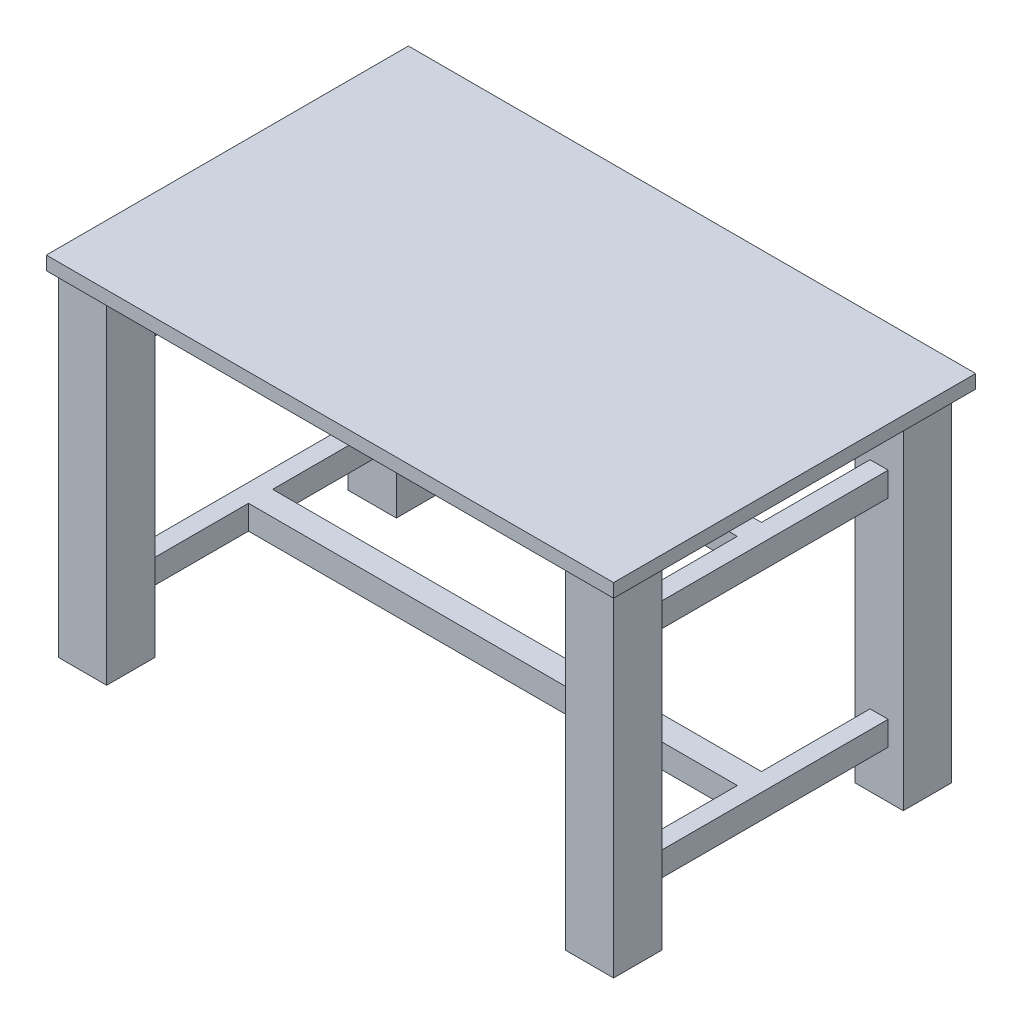
from build123d import *

# Parameters (mm, degrees)
BOSS_EXTRUDE1_DEPTH     = 704.85
CUT_EXTRUDE1_DEPTH      = 983.117366968
CUT_EXTRUDE1_DEPTH_BACK = 983.117366968
SKETCH2_W               = 508
SKETCH2_H               = 100
SKETCH2_H_2             = 403.25
SKETCH3_W               = 1193.8
SKETCH3_H               = 762
BOSS_EXTRUDE2_DEPTH     = 28.5


with BuildPart() as part:
    # Sketch1 → Boss-Extrude1 (new body)
    with BuildSketch(Plane(origin=(0, 0, 0), x_dir=(1, 0, 0), z_dir=(0, 1, 0))):
        Polygon((-584.2, 355.6), (-584.2, 254), (-552.45, 254), (-552.45, -254), (-584.2, -254), (-584.2, -355.6), (-482.6, -355.6), (-482.6, -254), (-514.35, -254), (-514.35, -25.4), (514.35, -25.4), (514.35, -254), (482.6, -254), (482.6, -355.6), (584.2, -355.6), (584.2, -254), (552.45, -254), (552.45, 254), (584.2, 254), (584.2, 355.6), (482.6, 355.6), (482.6, 254), (514.35, 254), (514.35, 25.4), (-514.35, 25.4), (-514.35, 254), (-482.6, 254), (-482.6, 355.6), align=None)
    extrude(amount=-BOSS_EXTRUDE1_DEPTH)

    # Sketch2 → Cut-Extrude1 (cut, two sides: drawn at the far end of the back side and taken through both)
    with BuildSketch(Plane(origin=(0, 0, 0), x_dir=(0, 0, -1), z_dir=(1, 0, 0)).offset(-CUT_EXTRUDE1_DEPTH_BACK)):
        with Locations((0, -50)):
            Rectangle(SKETCH2_W, SKETCH2_H)
        with Locations((0, -352.425)):
            Rectangle(SKETCH2_W, SKETCH2_H_2)
        with Locations((0, -654.85)):
            Rectangle(SKETCH2_W, SKETCH2_H)
    extrude(amount=CUT_EXTRUDE1_DEPTH + CUT_EXTRUDE1_DEPTH_BACK, mode=Mode.SUBTRACT)


with BuildPart() as body_2:
    # Sketch3 → Boss-Extrude2 (new body)
    with BuildSketch(Plane(origin=(0, 0, 0), x_dir=(1, 0, 0), z_dir=(0, 1, 0))):
        with Locations((0, 12.7)):
            Rectangle(SKETCH3_W, SKETCH3_H)
    extrude(amount=BOSS_EXTRUDE2_DEPTH)


solid = Compound([part.part, body_2.part])
